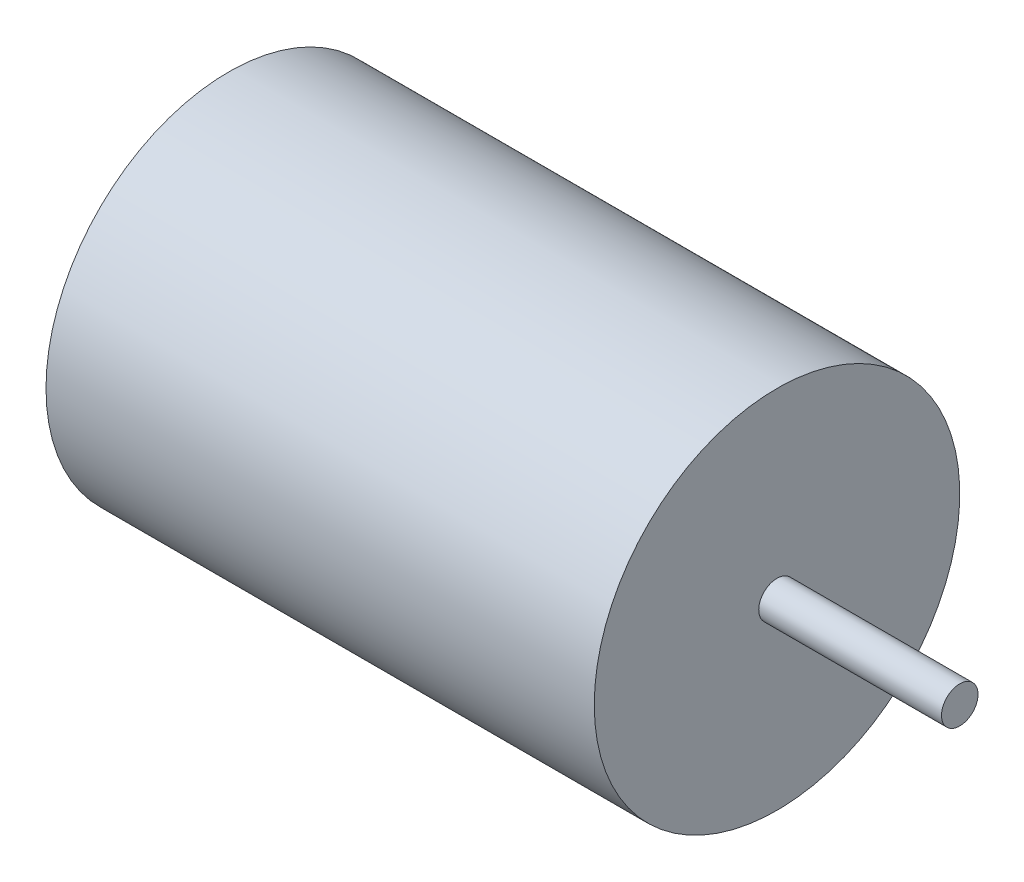
from build123d import *


with BuildPart() as part:
    # Esquisse1 → Révolution1 (revolve)
    with BuildSketch(Plane.XY):
        Polygon((10, 0), (10, 1), (0, 1), (0, 10), (-30, 10), (-30, 0), align=None)
    revolve(axis=Axis((-38.215059524, 0, 0), (1, 0, 0)))


solid = part.part
